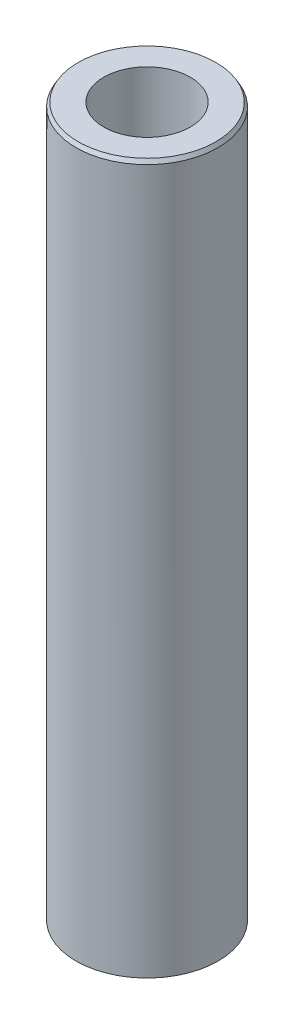
from build123d import *
from OCP.BRepFilletAPI import BRepFilletAPI_MakeChamfer

# Parameters (mm, degrees)
SKETCH1_R           = 60
BOSS_EXTRUDE1_DEPTH = 600
SKETCH2_R           = 36.513360907
CUT_EXTRUDE1_DEPTH  = 606.970296302
CHAMFER1_SIZE       = 3.317602589
CHAMFER1_SIZE2      = 1.915418748


with BuildPart() as part:
    # Sketch1 → Boss-Extrude1 (new body)
    with BuildSketch(Plane(origin=(0, 0, 0), x_dir=(1, 0, 0), z_dir=(0, 1, 0))):
        Circle(SKETCH1_R)
    extrude(amount=BOSS_EXTRUDE1_DEPTH)

    # Sketch2 → Cut-Extrude1 (cut, through all)
    with BuildSketch(Plane(origin=(0, 0, 0), x_dir=(1, 0, 0), z_dir=(0, 1, 0))):
        Circle(SKETCH2_R)
    extrude(amount=CUT_EXTRUDE1_DEPTH, mode=Mode.SUBTRACT)

    # Chamfer1: one chamfer whose edges measure the first distance from different faces: ONE call of the kernel's chamfer builder (chamfer() names one face for all edges)
    chamfer1_edges_1 = [part.edges().sort_by_distance(p)[0] for p in [
        (-60, 600, 0),
    ]]
    chamfer1_side_1 = [part.faces().sort_by_distance(p)[0] for p in [
        (-60, 300, 0),
    ]]
    chamfer1_edges_2 = [part.edges().sort_by_distance(p)[0] for p in [
        (-60, 0, 0),
    ]]
    chamfer1_side_2 = [part.faces().sort_by_distance(p)[0] for p in [
        (-58.302943725, 0, 0),
    ]]
    chamfer1 = BRepFilletAPI_MakeChamfer(part.part.solid().wrapped)
    for e in chamfer1_edges_1:
        chamfer1.Add(CHAMFER1_SIZE, CHAMFER1_SIZE2, e.wrapped, chamfer1_side_1[0].wrapped)  # the first distance lies on this face
    for e in chamfer1_edges_2:
        chamfer1.Add(CHAMFER1_SIZE, CHAMFER1_SIZE2, e.wrapped, chamfer1_side_2[0].wrapped)  # the first distance lies on this face
    add(Compound.cast(chamfer1.Shape()), mode=Mode.REPLACE)


solid = part.part
